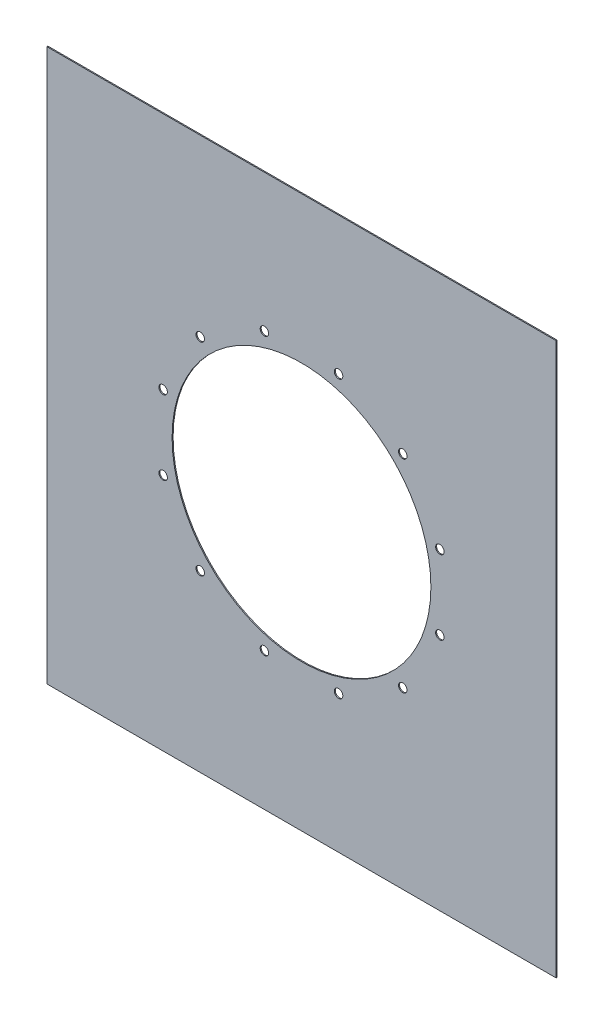
from build123d import *

# Parameters (mm, degrees)
SKETCH1_W          = 600
SKETCH1_H          = 650
SKETCH1_R          = 152.4
SKETCH1_R_2        = 5
BASE_FLANGE1_DEPTH = 1.2


# Sheet-metal steps are written as plain solids
with BuildPart() as part:
    # Sketch1 → Base-Flange1 (new body)
    with BuildSketch(Plane.XY):
        Rectangle(SKETCH1_W, SKETCH1_H)
        Circle(SKETCH1_R, mode=Mode.SUBTRACT)
        with Locations((43.662772909, 162.951686895)):
            Circle(SKETCH1_R_2, mode=Mode.SUBTRACT)
        with Locations((119.288913986, 119.288913986)):
            Circle(SKETCH1_R_2, mode=Mode.SUBTRACT)
        with Locations((162.951686895, 43.662772909)):
            Circle(SKETCH1_R_2, mode=Mode.SUBTRACT)
        with Locations((162.951686895, -43.662772909)):
            Circle(SKETCH1_R_2, mode=Mode.SUBTRACT)
        with Locations((119.288913986, -119.288913986)):
            Circle(SKETCH1_R_2, mode=Mode.SUBTRACT)
        with Locations((43.662772909, -162.951686895)):
            Circle(SKETCH1_R_2, mode=Mode.SUBTRACT)
        with Locations((-43.662772909, -162.951686895)):
            Circle(SKETCH1_R_2, mode=Mode.SUBTRACT)
        with Locations((-119.288913986, -119.288913986)):
            Circle(SKETCH1_R_2, mode=Mode.SUBTRACT)
        with Locations((-162.951686895, -43.662772909)):
            Circle(SKETCH1_R_2, mode=Mode.SUBTRACT)
        with Locations((-162.951686895, 43.662772909)):
            Circle(SKETCH1_R_2, mode=Mode.SUBTRACT)
        with Locations((-119.288913986, 119.288913986)):
            Circle(SKETCH1_R_2, mode=Mode.SUBTRACT)
        with Locations((-43.662772909, 162.951686895)):
            Circle(SKETCH1_R_2, mode=Mode.SUBTRACT)
    extrude(amount=-BASE_FLANGE1_DEPTH)


solid = part.part
